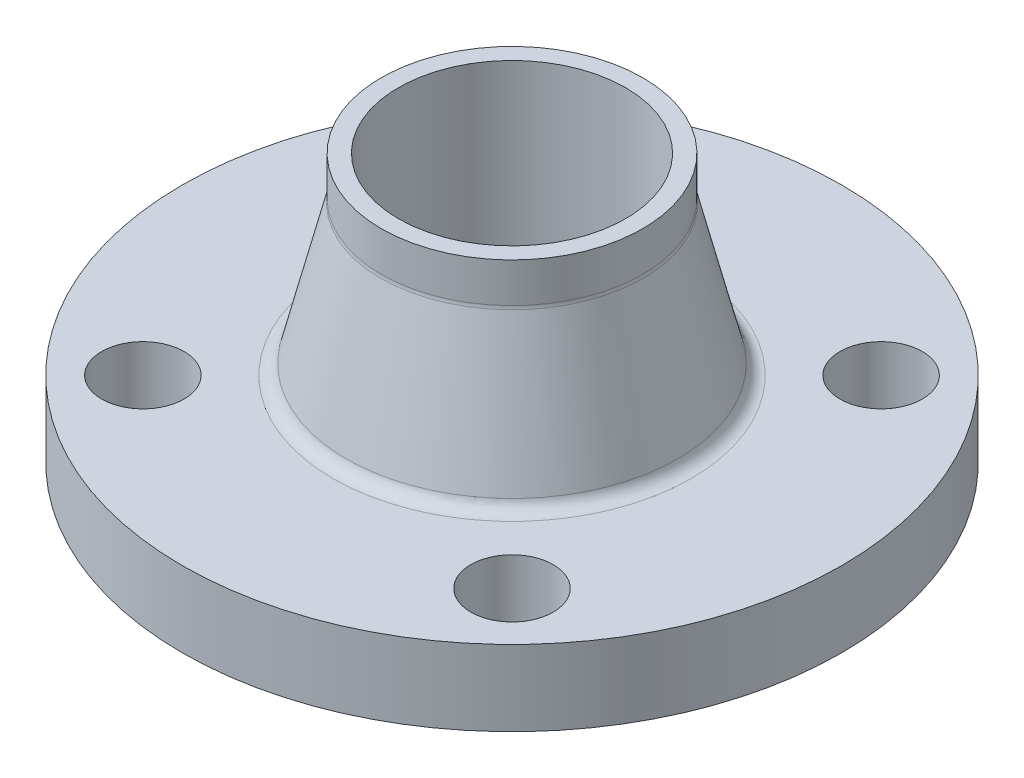
from build123d import *

# Parameters (mm, degrees)
SKETCH4_R               = 9.525
F_1ST_BOLT_HOLE_DEPTH   = 117.570504417
BOLT_HOLE_PATTERN_COUNT = 4


with BuildPart() as part:
    # Sketch3 → Base-Revolve (revolve)
    with BuildSketch(Plane.XY):
        with BuildLine():
            Line((26.2509, 61.9125), (26.2509, -1.5875))
            Line((26.2509, -1.5875), (46.0375, -1.5875))
            Line((46.0375, -1.5875), (46.0375, 0))
            Line((46.0375, 0), (76.2, 0))
            Line((76.2, 0), (76.2, 17.4625))
            Line((76.2, 17.4625), (41.377092519, 17.4625))
            ThreePointArc((41.377092519, 17.4625), (39.421017335, 18.13662118), (38.295576299, 19.872723702))
            Line((38.295576299, 19.872723702), (30.31948378, 52.010825428))
            ThreePointArc((30.31948378, 52.010825428), (30.2494576, 52.390367381), (30.226, 52.775601727))
            Line((30.226, 52.775601727), (30.226, 61.9125))
            Line((30.226, 61.9125), (26.2509, 61.9125))
        make_face()
    revolve(axis=Axis((0, 0, 0), (0, 1, 0)))

    # Sketch4 → 1st Bolt Hole (cut, through all)
    with BuildSketch(Plane(origin=(0, 17.4625, 0), x_dir=(-1, 0, 0), z_dir=(0, 1, 0))):
        with Locations((-42.656216575, 42.656216575)):
            Circle(SKETCH4_R)
    f_1st_bolt_hole = extrude(amount=-F_1ST_BOLT_HOLE_DEPTH, mode=Mode.SUBTRACT)

    # Bolt Hole Pattern: 1st Bolt Hole ×4 about axis
    bolt_hole_pattern_axis = Axis((0, 17.4625, 0), (0, -1, 0))
    for i in range(1, BOLT_HOLE_PATTERN_COUNT):
        add(f_1st_bolt_hole.rotate(bolt_hole_pattern_axis, i * 360 / BOLT_HOLE_PATTERN_COUNT), mode=Mode.SUBTRACT)


solid = part.part
